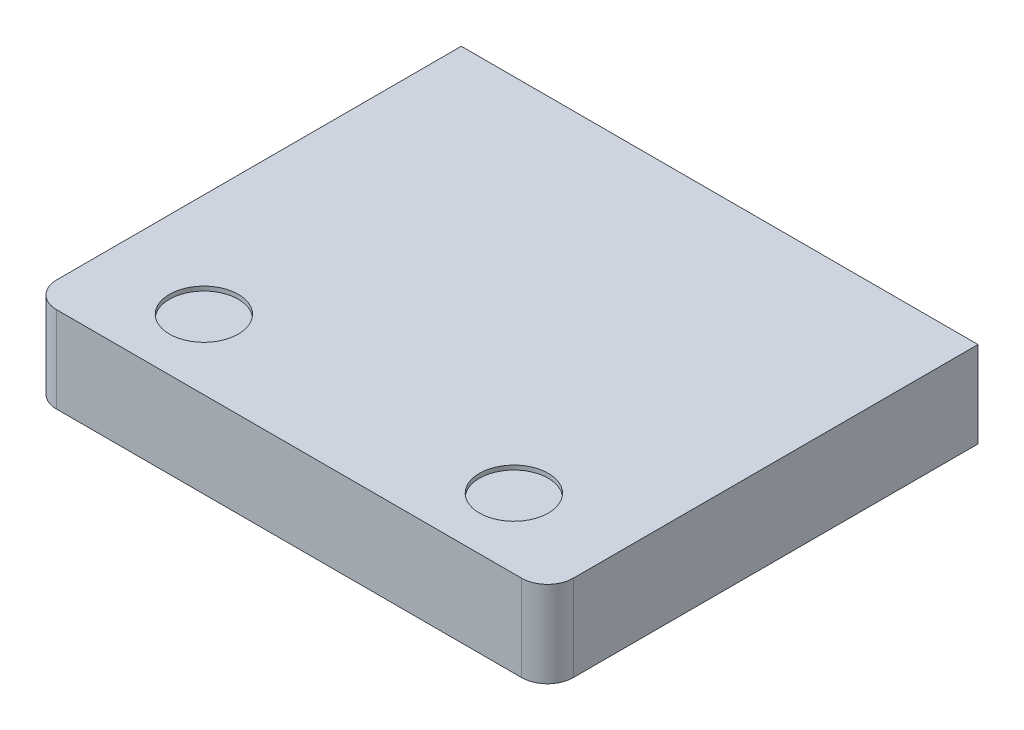
from build123d import *

# Parameters (mm, degrees)
SKETCH_1_W          = 60
SKETCH_1_H          = 50
EXTRUDE_1_DEPTH     = 10
FILLET_1_R          = 3
SKETCH_2_R          = 4
CUT_EXTRUDE_1_DEPTH = 0.5


with BuildPart() as part:
    # 草图1 → 凸台-拉伸1 (new body)
    with BuildSketch(Plane(origin=(0, 0, 0), x_dir=(1, 0, 0), z_dir=(0, 1, 0))):
        Rectangle(SKETCH_1_W, SKETCH_1_H)
    extrude(amount=EXTRUDE_1_DEPTH)

    # 圆角1
    fillet_1_edges = [part.edges().sort_by_distance(p)[0] for p in [
        (-30, 5, 25),
        (30, 5, 25),
    ]]
    fillet(fillet_1_edges, radius=FILLET_1_R)

    # 草图2 → 切除-拉伸1 (cut)
    with BuildSketch(Plane(origin=(0, 10, 0), x_dir=(1, 0, 0), z_dir=(0, 1, 0))):
        with Locations((-18, -16.9)):
            Circle(SKETCH_2_R)
        with Locations((18, -16.9)):
            Circle(SKETCH_2_R)
    extrude(amount=-CUT_EXTRUDE_1_DEPTH, mode=Mode.SUBTRACT)


solid = part.part
